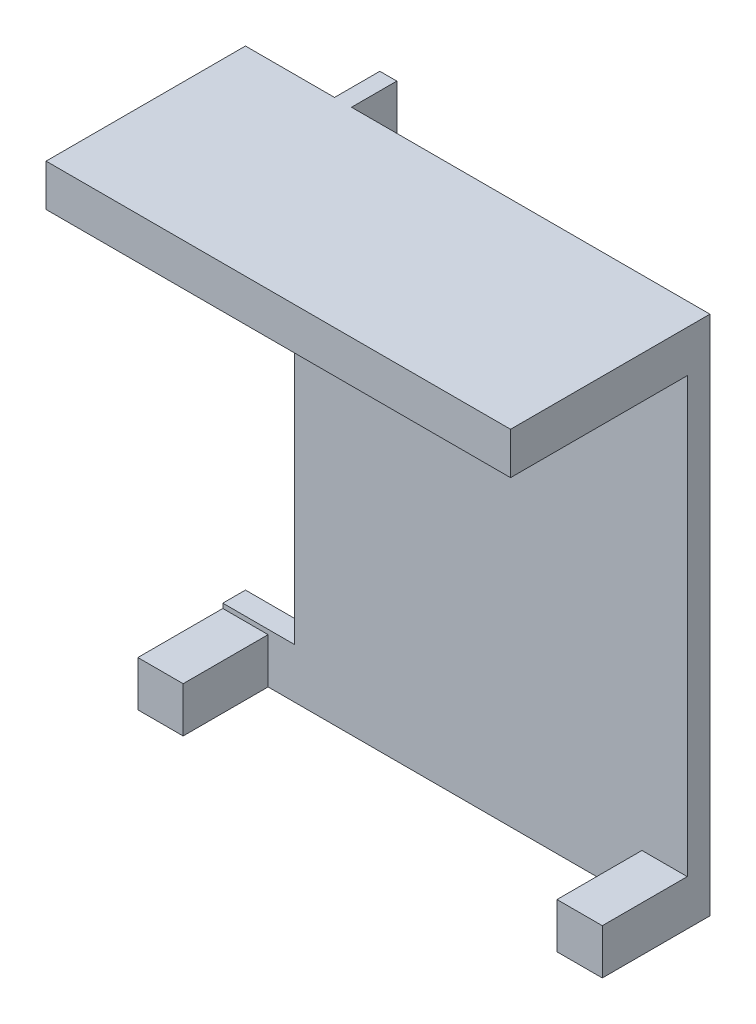
from build123d import *

# Parameters (mm, degrees)
SCHIZZO1_W                   = 41
SCHIZZO1_H                   = 46
ESTRUSIONE_ESTRUSIONE1_DEPTH = 2
SCHIZZO2_W                   = 4
SCHIZZO2_H                   = 4
ESTRUSIONE_ESTRUSIONE2_DEPTH = 7.5
SCHIZZO3_W                   = 41
SCHIZZO3_H                   = 3.7
ESTRUSIONE_ESTRUSIONE3_DEPTH = 15.6
SCHIZZO4_W                   = 6.315683346
SCHIZZO4_H                   = 34.34145986
TAGLIO_ESTRUSIONE1_DEPTH     = 2
SCHIZZO5_W                   = 1.5
SCHIZZO5_H                   = 14
ESTRUSIONE_ESTRUSIONE4_DEPTH = 4


with BuildPart() as part:
    # Schizzo1 → Estrusione-Estrusione1 (new body)
    with BuildSketch(Plane.XY):
        with Locations((20.5, 23)):
            Rectangle(SCHIZZO1_W, SCHIZZO1_H)
    extrude(amount=ESTRUSIONE_ESTRUSIONE1_DEPTH)

    # Schizzo2 → Estrusione-Estrusione2 (add)
    with BuildSketch(Plane.XY.offset(2)):
        with Locations((2, 2)):
            Rectangle(SCHIZZO2_W, SCHIZZO2_H)
        with Locations((39, 2)):
            Rectangle(SCHIZZO2_W, SCHIZZO2_H)
    extrude(amount=ESTRUSIONE_ESTRUSIONE2_DEPTH)

    # Schizzo3 → Estrusione-Estrusione3 (add)
    with BuildSketch(Plane.XY.offset(2)):
        with Locations((20.5, 44.15)):
            Rectangle(SCHIZZO3_W, SCHIZZO3_H)
    extrude(amount=ESTRUSIONE_ESTRUSIONE3_DEPTH)

    # Schizzo4 → Taglio-Estrusione1 (cut)
    with BuildSketch(Plane(origin=(0, 0, 0), x_dir=(-1, 0, 0), z_dir=(0, 0, -1))):
        with Locations((-3.157841673, 21.578763697)):
            Rectangle(SCHIZZO4_W, SCHIZZO4_H)
    extrude(amount=-TAGLIO_ESTRUSIONE1_DEPTH, mode=Mode.SUBTRACT)

    # Schizzo5 → Estrusione-Estrusione4 (add)
    with BuildSketch(Plane(origin=(0, 0, 0), x_dir=(-1, 0, 0), z_dir=(0, 0, -1))):
        with Locations((-8.611501058, 39)):
            Rectangle(SCHIZZO5_W, SCHIZZO5_H)
    extrude(amount=ESTRUSIONE_ESTRUSIONE4_DEPTH)


solid = part.part
